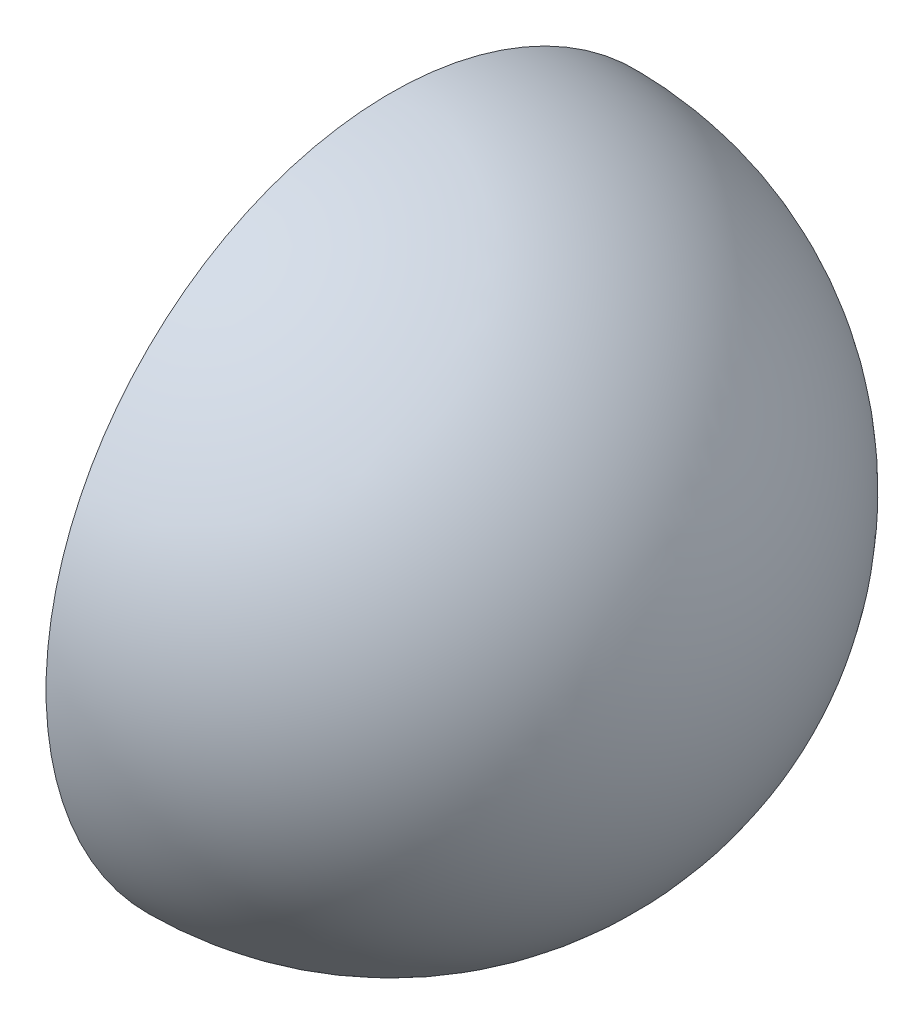
from build123d import *

# Parameters (mm, degrees)
REVOLVE3_ANGLE = 180


with BuildPart() as part:
    # Sketch1 → Revolve3 (revolve)
    with BuildSketch(Plane.YZ):
        with BuildLine():
            Line((0, 6), (0, -6))
            ThreePointArc((0, -6), (6, 0), (0, 6))
        make_face()
    revolve(axis=Axis((0, 0, 7.615816768), (0, 0, -1)), revolution_arc=REVOLVE3_ANGLE)


solid = part.part
